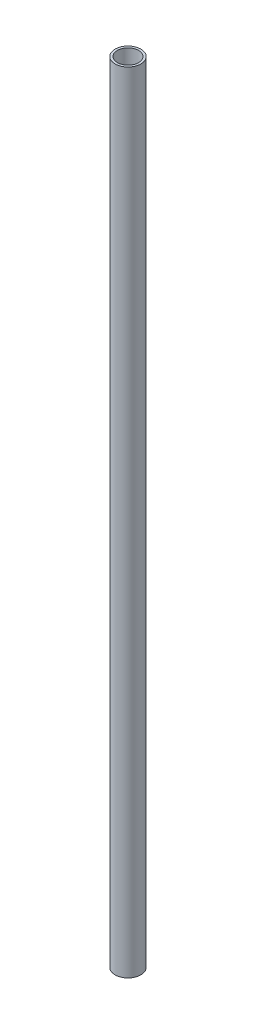
from build123d import *

# Parameters (mm, degrees)
SKETCH1_R           = 17.4625
SKETCH1_R_2         = 14.4145
BOSS_EXTRUDE1_DEPTH = 1070


with BuildPart() as part:
    # Sketch1 → Boss-Extrude1 (new body)
    with BuildSketch(Plane(origin=(0, 0, 0), x_dir=(1, 0, 0), z_dir=(0, 1, 0))):
        Circle(SKETCH1_R)
        Circle(SKETCH1_R_2, mode=Mode.SUBTRACT)
    extrude(amount=BOSS_EXTRUDE1_DEPTH)


solid = part.part
